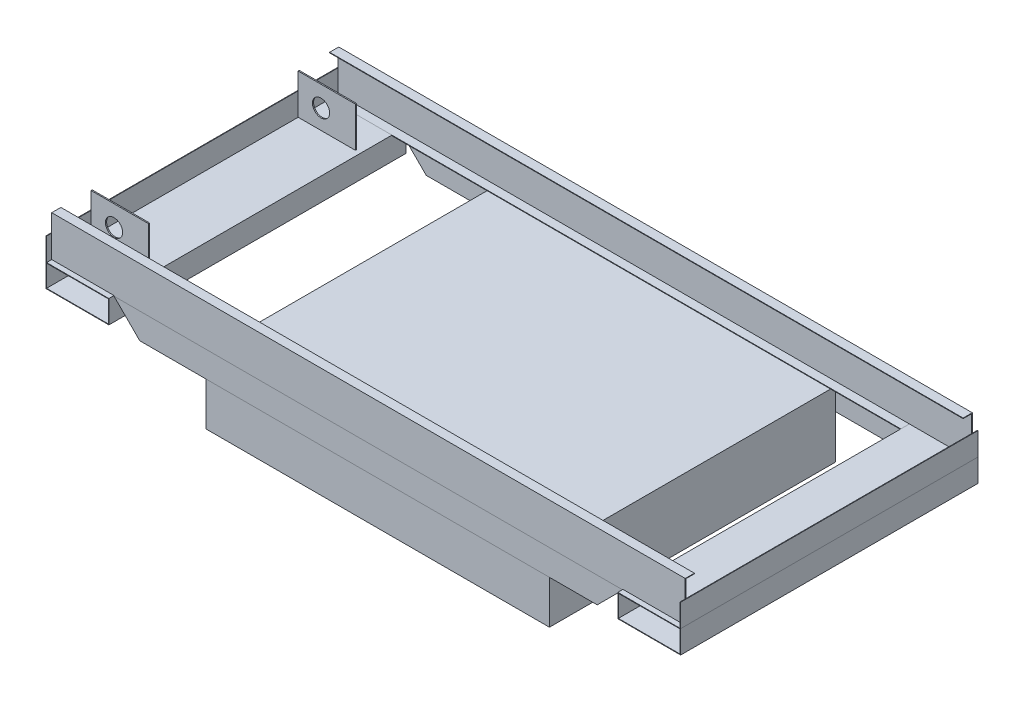
from build123d import *

# Parameters (mm, degrees)
SHEET_EXTRUDE_1_1_BACK  = 260
SHEET_EXTRUDE_1_1_DEPTH = 520
THICKEN_1_T2            = 1
THICKEN_START           = 20
THICKEN_2_OUTLINE_W     = 1
THICKEN_2_OUTLINE_H     = 520
THICKEN_2_DEPTH         = 40
THICKEN_START_2         = -54
THICKEN_3_DEPTH         = 1108
EXTRUDE_1_DEPTH         = 1
SKETCH_5_W              = 100
SKETCH_5_H              = 70
EXTRUDE_2_DEPTH         = 2
SKETCH_6_R              = 15
CUT_EXTRUDE_1_DEPTH     = 200
SKETCH_7_W              = 600.703712977
SKETCH_7_H              = 115
EXTRUDE_3_DEPTH         = 500
SCALE_1_SCALE           = 0.6


# Read off the part's stored shape, not the designer's step: 加厚2, 加厚3
with BuildPart() as body_1:
    # Sheet 凸台-拉伸1: a surface, the sketch's curves swept straight by 520 mm
    with BuildLine(Plane.XY.offset(-SHEET_EXTRUDE_1_1_BACK), mode=Mode.PRIVATE) as sheet_extrude_1_1_path:
        Line((-55, 20), (55, 20))
        Line((55, 20), (55, -20))
        Line((55, -20), (-55, -20))
        Line((-55, -20), (-55, 20))
    sheet_extrude_1_1 = Shell.extrude(sheet_extrude_1_1_path.wire(), (0 * SHEET_EXTRUDE_1_1_DEPTH, 0 * SHEET_EXTRUDE_1_1_DEPTH, 1 * SHEET_EXTRUDE_1_1_DEPTH))
    add(Solid.thicken(sheet_extrude_1_1, -THICKEN_1_T2))


with BuildPart() as body_2:
    # 加厚2 outline → 加厚2 (new body)
    with BuildSketch(Plane(origin=(0, 0, 0), x_dir=(1, 0, 0), z_dir=(0, 1, 0)).offset(THICKEN_START)):
        with Locations((-54.5, 0)):
            Rectangle(THICKEN_2_OUTLINE_W, THICKEN_2_OUTLINE_H)
    extrude(amount=THICKEN_2_DEPTH)


with BuildPart() as body_3:
    # 镜向2: mirrored copy
    add(body_1.part.mirror(Plane(origin=(500, 0, 0), x_dir=(0, 0, 1), z_dir=(1, 0, 0))))


with BuildPart() as body_4:
    # Mirror 2 2: mirrored copy
    add(body_2.part.mirror(Plane(origin=(500, 0, 0), x_dir=(0, 0, 1), z_dir=(1, 0, 0))))


with BuildPart() as body_5:
    # 加厚3 outline → 加厚3 (new body)
    with BuildSketch(Plane.YZ.offset(THICKEN_START_2)):
        Polygon((19, 235), (20, 235), (20, 250), (90, 250), (90, 235), (91, 235), (91, 251), (19, 251), align=None)
    extrude(amount=THICKEN_3_DEPTH)


with BuildPart() as body_6:
    # 镜向3: mirrored copy
    add(body_5.part.mirror(Plane.XY))


with BuildPart() as body_7:
    # 草图4 → 凸台-拉伸1 (new body)
    with BuildSketch(Plane.XY.offset(251)):
        Polygon((55, 19), (100, -26), (900, -26), (945, 19), align=None)
    extrude(amount=-EXTRUDE_1_DEPTH)


with BuildPart() as body_8:
    # 镜向4: mirrored copy
    add(body_7.part.mirror(Plane.XY))


with BuildPart() as body_9:
    # 草图5 → 凸台-拉伸2 (new body)
    with BuildSketch(Plane.XY.offset(180)):
        with Locations((-4, 55)):
            Rectangle(SKETCH_5_W, SKETCH_5_H)
    extrude(amount=EXTRUDE_2_DEPTH)


with BuildPart() as body_10:
    # 镜向5: mirrored copy
    add(body_9.part.mirror(Plane.XY))


with BuildPart() as cut_extrude_1_tool:
    # 草图6 → 切除-拉伸1 (new, symmetric)
    with BuildSketch(Plane.XY):
        with Locations((-14, 54)):
            Circle(SKETCH_6_R)
    extrude(amount=CUT_EXTRUDE_1_DEPTH, both=True)


with BuildPart() as body_9_1:
    add(body_9.part)

    # 切除-拉伸1: cut by cut_extrude_1_tool
    add(cut_extrude_1_tool.part, mode=Mode.SUBTRACT)


with BuildPart() as body_10_1:
    add(body_10.part)

    # 切除-拉伸1: cut by cut_extrude_1_tool
    add(cut_extrude_1_tool.part, mode=Mode.SUBTRACT)


with BuildPart() as body_7_1:
    add(body_7.part)

    add(body_8.part)  # 凸台-拉伸3 merges body 8
    # 草图7 → 凸台-拉伸3 (add)
    with BuildSketch(Plane(origin=(0, 0, 250), x_dir=(-1, 0, 0), z_dir=(0, 0, -1))):
        with Locations((-515.152886454, -45.152554207)):
            Rectangle(SKETCH_7_W, SKETCH_7_H)
    extrude(amount=EXTRUDE_3_DEPTH)


with BuildPart() as body_1_1:
    # 缩放比例1: scaled about (0, 0, 0)
    add(body_1.part.scale(SCALE_1_SCALE))


with BuildPart() as body_7_2:
    # 缩放比例1: scaled about (0, 0, 0)
    add(body_7_1.part.scale(SCALE_1_SCALE))


with BuildPart() as body_4_1:
    # 缩放比例1: scaled about (0, 0, 0)
    add(body_4.part.scale(SCALE_1_SCALE))


with BuildPart() as body_5_1:
    # 缩放比例1: scaled about (0, 0, 0)
    add(body_5.part.scale(SCALE_1_SCALE))


with BuildPart() as body_9_2:
    # 缩放比例1: scaled about (0, 0, 0)
    add(body_9_1.part.scale(SCALE_1_SCALE))


with BuildPart() as body_6_1:
    # 缩放比例1: scaled about (0, 0, 0)
    add(body_6.part.scale(SCALE_1_SCALE))


with BuildPart() as body_3_1:
    # 缩放比例1: scaled about (0, 0, 0)
    add(body_3.part.scale(SCALE_1_SCALE))


with BuildPart() as body_10_2:
    # 缩放比例1: scaled about (0, 0, 0)
    add(body_10_1.part.scale(SCALE_1_SCALE))


with BuildPart() as body_2_1:
    # 缩放比例1: scaled about (0, 0, 0)
    add(body_2.part.scale(SCALE_1_SCALE))


solid = Compound([body_1_1.part, body_7_2.part, body_4_1.part, body_5_1.part, body_9_2.part, body_6_1.part, body_3_1.part, body_10_2.part, body_2_1.part])
